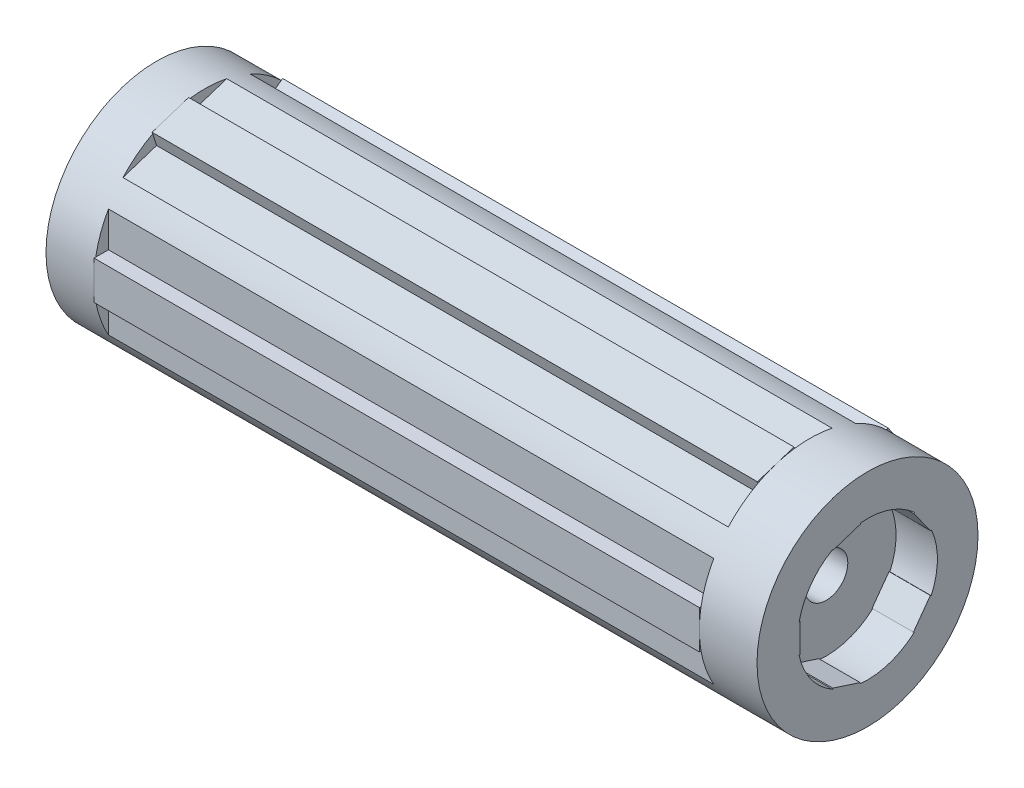
from build123d import *

# Parameters (mm, degrees)
SKIZZE1_R                                 = 11.5
GRUNDK_RPER_WALZE_DEPTH                   = 74
PRESSPASSUNG_KUGELLAGER_DEPTH             = 4.3
SKIZZE3_R                                 = 2.25
M4_SCHRAUBENF_HRUNG_DEPTH                 = 4.5
SKIZZE4_R                                 = 9.675
MOTORAUSSPARUNG_DEPTH                     = 12.75
ZERST_RUNGSELEMENT_START                  = -6
SKIZZE7_W                                 = 1.5
SKIZZE7_H                                 = 15
ZERST_RUNGSELEMENT_AUSSPARUNG_DEPTH       = 63
SKIZZE8_W                                 = 63
SKIZZE8_H                                 = 4
ZERST_RUNGSELEMENT_RECHTECK_DEPTH         = 1.5
M5_MOTOR_MUTTER_DEPTH                     = 12
SKIZZE12_R                                = 3.1
M5_AUSLAUF_SCHRAUBE_DEPTH                 = 2
ZERST_RUNGSELEMENT_VERVIELF_LTIGUNG_COUNT = 5


with BuildPart() as part:
    # Skizze1 → Grundkörper Walze (new body)
    with BuildSketch(Plane(origin=(0, 0, 0), x_dir=(0, 0, -1), z_dir=(1, 0, 0))):
        Circle(SKIZZE1_R)
    extrude(amount=GRUNDK_RPER_WALZE_DEPTH)

    # Skizze2 → Presspassung Kugellager (cut)
    with BuildSketch(Plane(origin=(74, 0, 0), x_dir=(0, 0, -1), z_dir=(1, 0, 0))):
        with BuildLine():
            Line((-7.1137911, 1.5230237), (-7.0137911, 1.5230237))
            Line((-7.0137911, 1.5230237), (-7.0137911, -1.4769763))
            Line((-7.0137911, -1.4769763), (-7.123493947, -1.4769763))
            ThreePointArc((-7.123493947, -1.4769763), (-5.899398016, -4.257079756), (-3.646763959, -6.294977175))
            Line((-3.646763959, -6.294977175), (-3.61586226, -6.199871523))
            Line((-3.61586226, -6.199871523), (-0.762692711, -7.126922506))
            Line((-0.762692711, -7.126922506), (-0.796592755, -7.231256114))
            ThreePointArc((-0.796592755, -7.231256114), (2.225709199, -6.926170916), (4.859967024, -5.413533553))
            Line((4.859967024, -5.413533553), (4.779065325, -5.354755027))
            Line((4.779065325, -5.354755027), (6.542421081, -2.927704044))
            Line((6.542421081, -2.927704044), (6.631172549, -2.99218576))
            ThreePointArc((6.631172549, -2.99218576), (7.27496195, -0.023529282), (6.650388764, 2.94922944))
            Line((6.650388764, 2.94922944), (6.569487065, 2.890450915))
            Line((6.569487065, 2.890450915), (4.806131308, 5.317501898))
            Line((4.806131308, 5.317501898), (4.894882775, 5.381983613))
            ThreePointArc((4.894882775, 5.381983613), (2.270464553, 6.91162902), (-0.749800729, 7.236257587))
            Line((-0.749800729, 7.236257587), (-0.71889903, 7.141151935))
            Line((-0.71889903, 7.141151935), (-3.572068579, 6.214100952))
            Line((-3.572068579, 6.214100952), (-3.605968623, 6.31843456))
            ThreePointArc((-3.605968623, 6.31843456), (-5.871737686, 4.295150934), (-7.1137911, 1.5230237))
        make_face()
    extrude(amount=-PRESSPASSUNG_KUGELLAGER_DEPTH, mode=Mode.SUBTRACT)

    # Skizze3 → M4 Schraubenführung (cut)
    with BuildSketch(Plane(origin=(69.7, 0, 0), x_dir=(0, 0, -1), z_dir=(1, 0, 0))):
        Circle(SKIZZE3_R)
    extrude(amount=-M4_SCHRAUBENF_HRUNG_DEPTH, mode=Mode.SUBTRACT)

    # Skizze4 → Motoraussparung (cut)
    with BuildSketch(Plane.ZY):
        Circle(SKIZZE4_R)
    extrude(amount=-MOTORAUSSPARUNG_DEPTH, mode=Mode.SUBTRACT)

    # Skizze7 → Zerstörungselement Aussparung (cut)
    with BuildSketch(Plane(origin=(74, 0, 0), x_dir=(0, 0, -1), z_dir=(1, 0, 0)).offset(ZERST_RUNGSELEMENT_START)):
        with Locations((-10.75, 0)):
            Rectangle(SKIZZE7_W, SKIZZE7_H)
    zerst_rungselement_aussparung = extrude(amount=-ZERST_RUNGSELEMENT_AUSSPARUNG_DEPTH, mode=Mode.SUBTRACT)

    # Skizze8 → Zerstörungselement Rechteck (add)
    with BuildSketch(Plane.XY.offset(10)):
        with Locations((36.5, 0)):
            Rectangle(SKIZZE8_W, SKIZZE8_H)
    zerst_rungselement_rechteck = extrude(amount=ZERST_RUNGSELEMENT_RECHTECK_DEPTH)

    # Skizze10 → M5 Motor Mutter (cut)
    with BuildSketch(Plane.ZY.offset(-12.75)):
        Polygon((4.139835299, -2.29675794), (4.058968371, 2.436823566), (-0.080866927, 4.733581506), (-4.139835299, 2.29675794), (-4.058968371, -2.436823566), (0.080866927, -4.733581506), align=None)
    extrude(amount=-M5_MOTOR_MUTTER_DEPTH, mode=Mode.SUBTRACT)

    # Skizze12 → M5 Auslauf Schraube (cut)
    with BuildSketch(Plane.ZY.offset(-24.75)):
        Circle(SKIZZE12_R)
    extrude(amount=-M5_AUSLAUF_SCHRAUBE_DEPTH, mode=Mode.SUBTRACT)

    # Zerstörungselement Vervielfältigung: Zerstörungselement Aussparung, Zerstörungselement Rechteck ×5 about axis
    zerst_rungselement_vervielf_ltigung_axis = Axis((74, 0, 0), (-1, 0, 0))
    add([zerst_rungselement_aussparung.rotate(zerst_rungselement_vervielf_ltigung_axis, i * 360 / ZERST_RUNGSELEMENT_VERVIELF_LTIGUNG_COUNT) for i in range(1, ZERST_RUNGSELEMENT_VERVIELF_LTIGUNG_COUNT)], mode=Mode.SUBTRACT)
    add([zerst_rungselement_rechteck.rotate(zerst_rungselement_vervielf_ltigung_axis, i * 360 / ZERST_RUNGSELEMENT_VERVIELF_LTIGUNG_COUNT) for i in range(1, ZERST_RUNGSELEMENT_VERVIELF_LTIGUNG_COUNT)])

    # Skizze15 → Schnitt-Rotation1 (revolve, cut)
    with BuildSketch(Plane.XY):
        Polygon((27.25, 0), (35.75, 8.5), (65.2, 8.5), (65.2, 0), align=None)
    revolve(axis=Axis((-6.893942049, 0, 0), (1, 0, 0)), mode=Mode.SUBTRACT)


solid = part.part
